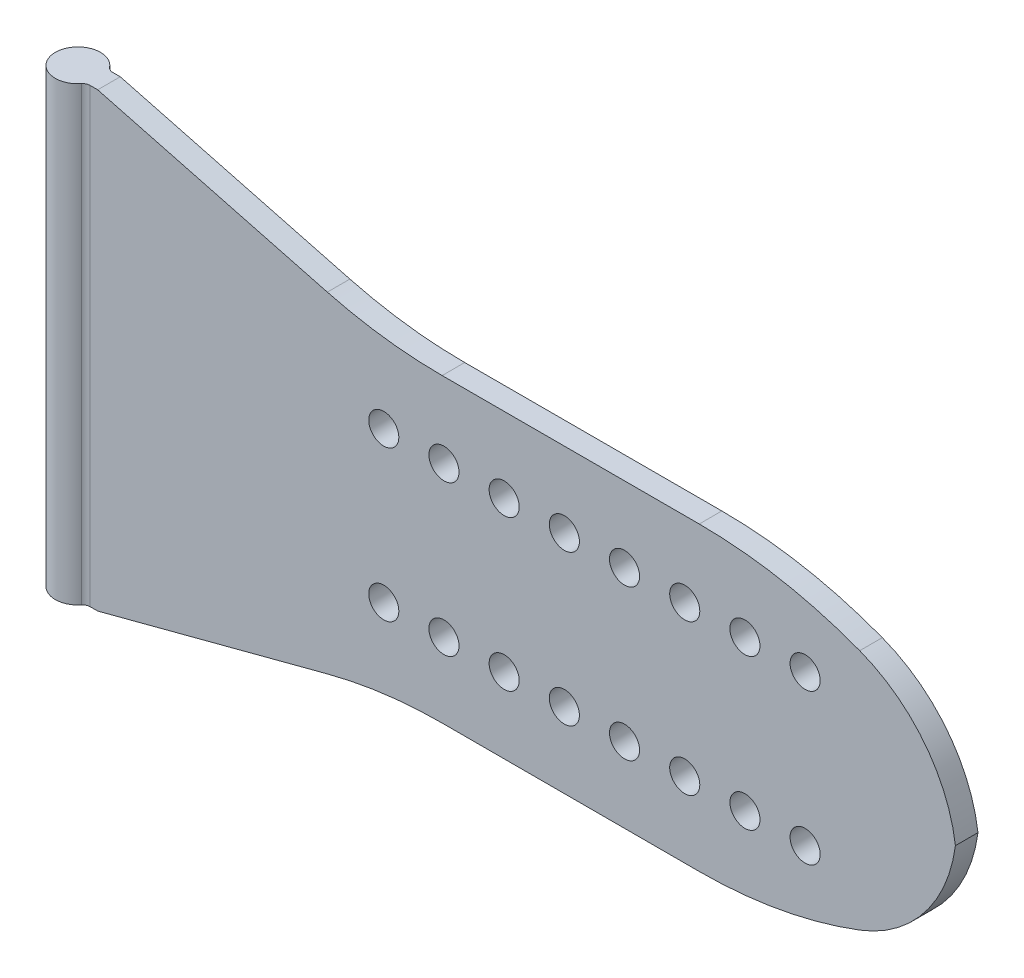
from build123d import *

# Parameters (mm, degrees)
BOSS_EXTRUDE1_DEPTH      = 15
BOSS_EXTRUDE1_DEPTH_BACK = 15
SKETCH2_R                = 1
CUT_EXTRUDE1_DEPTH       = 62.064988474
FILLET1_R                = 30
FILLET2_R                = 10


with BuildPart() as part:
    # Sketch1 → Boss-Extrude1 (new, two sides: drawn at the far end of the back side and taken through both)
    with BuildSketch(Plane(origin=(0, 0, 0), x_dir=(1, 0, 0), z_dir=(0, 1, 0)).offset(-BOSS_EXTRUDE1_DEPTH_BACK)):
        with BuildLine():
            Line((1.5612495, 0.75), (59.1512495, 0.75))
            Line((59.1512495, 0.75), (59.1512495, -0.75))
            Line((59.1512495, -0.75), (1.5612495, -0.75))
            ThreePointArc((1.5612495, -0.75), (1.344743149, -0.799306091), (1.170937125, -0.9375))
            ThreePointArc((1.170937125, -0.9375), (-1.5, 0), (1.170937125, 0.9375))
            ThreePointArc((1.170937125, 0.9375), (1.344743149, 0.799306091), (1.5612495, 0.75))
        make_face()
    extrude(amount=BOSS_EXTRUDE1_DEPTH + BOSS_EXTRUDE1_DEPTH_BACK)

    # Sketch2 → Cut-Extrude1 (cut, through all)
    with BuildSketch(Plane.XY.offset(0.75)):
        with Locations((49.0772495, 5)):
            Circle(SKETCH2_R)
        with Locations((45.0772495, 5)):
            Circle(SKETCH2_R)
        with Locations((41.0772495, 5)):
            Circle(SKETCH2_R)
        with Locations((37.0772495, 5)):
            Circle(SKETCH2_R)
        with Locations((33.0772495, 5)):
            Circle(SKETCH2_R)
        with Locations((29.0772495, 5)):
            Circle(SKETCH2_R)
        with Locations((25.0772495, 5)):
            Circle(SKETCH2_R)
        with Locations((21.0772495, 5)):
            Circle(SKETCH2_R)
        with Locations((45.0772495, -5)):
            Circle(SKETCH2_R)
        with Locations((41.0772495, -5)):
            Circle(SKETCH2_R)
        with Locations((37.0772495, -5)):
            Circle(SKETCH2_R)
        with Locations((33.0772495, -5)):
            Circle(SKETCH2_R)
        with Locations((29.0772495, -5)):
            Circle(SKETCH2_R)
        with Locations((25.0772495, -5)):
            Circle(SKETCH2_R)
        with Locations((21.0772495, -5)):
            Circle(SKETCH2_R)
        with Locations((49.0772495, -5)):
            Circle(SKETCH2_R)
        Polygon((49.0772495, 10), (21.0772495, 10), (2.0652495, 15), (59.1512495, 15), (59.1512495, 5), align=None)
        Polygon((49.0772495, -10), (21.0772495, -10), (2.0652495, -15), (59.1512495, -15), (59.1512495, -5), align=None)
    extrude(amount=-CUT_EXTRUDE1_DEPTH, mode=Mode.SUBTRACT)

    # Fillet1
    fillet1_edges = [part.edges().sort_by_distance(p)[0] for p in [
        (49.0772495, 10, 0),
        (21.0772495, 10, 0),
        (49.0772495, -10, 0),
        (21.0772495, -10, 0),
    ]]
    fillet(fillet1_edges, radius=FILLET1_R)

    # Fillet2
    # the kernel refuses this fillet: 10 mm, written as the material it takes off along each edge
    with BuildSketch(Plane(origin=(59.1512495, -5, 18.566207641), x_dir=(-0.9044112472912746, -0.42666180491466615, 0), z_dir=(0, 0, -1))) as fillet2_piece_1:
        with BuildLine():
            CenterArc((6.353468821, 9.970077682), FILLET2_R, 205.255895662, 69.177572528)
            Line((-2.690643652, 5.703459633), (-3.595054899, 5.276797828))
            Line((-3.595054899, 5.276797828), (-0.904411247, -0.426661805))
            Line((-0.904411247, -0.426661805), (-0.019905188, -0.999801872))
            ThreePointArc((-0.019905188, -0.999801872), (4.190379521, -1.083624989), (7.20378448, -0.997007768))
            Line((7.20378448, -0.997007768), (7.126483056, 0))
        make_face()
    extrude(amount=37.132415281, mode=Mode.SUBTRACT)
    with BuildSketch(Plane(origin=(59.1512495, 5, 18.566207641), x_dir=(0, -1, 0), z_dir=(0, 0, -1))) as fillet2_piece_2:
        with BuildLine():
            CenterArc((6.306267918, 10), FILLET2_R, 200.822427472, 69.177572528)
            Line((-3.040598123, 6.44527143), (-3.975284728, 6.089798573))
            ThreePointArc((-3.975284728, 6.089798573), (-2.767917517, 3.327484976), (-0.895739275, -0.444579747))
            Line((-0.895739275, -0.444579747), (0, -1))
            Line((0, -1), (6.306267918, -1))
            Line((6.306267918, -1), (6.306267918, 0))
        make_face()
    extrude(amount=37.132415281, mode=Mode.SUBTRACT)


solid = part.part
